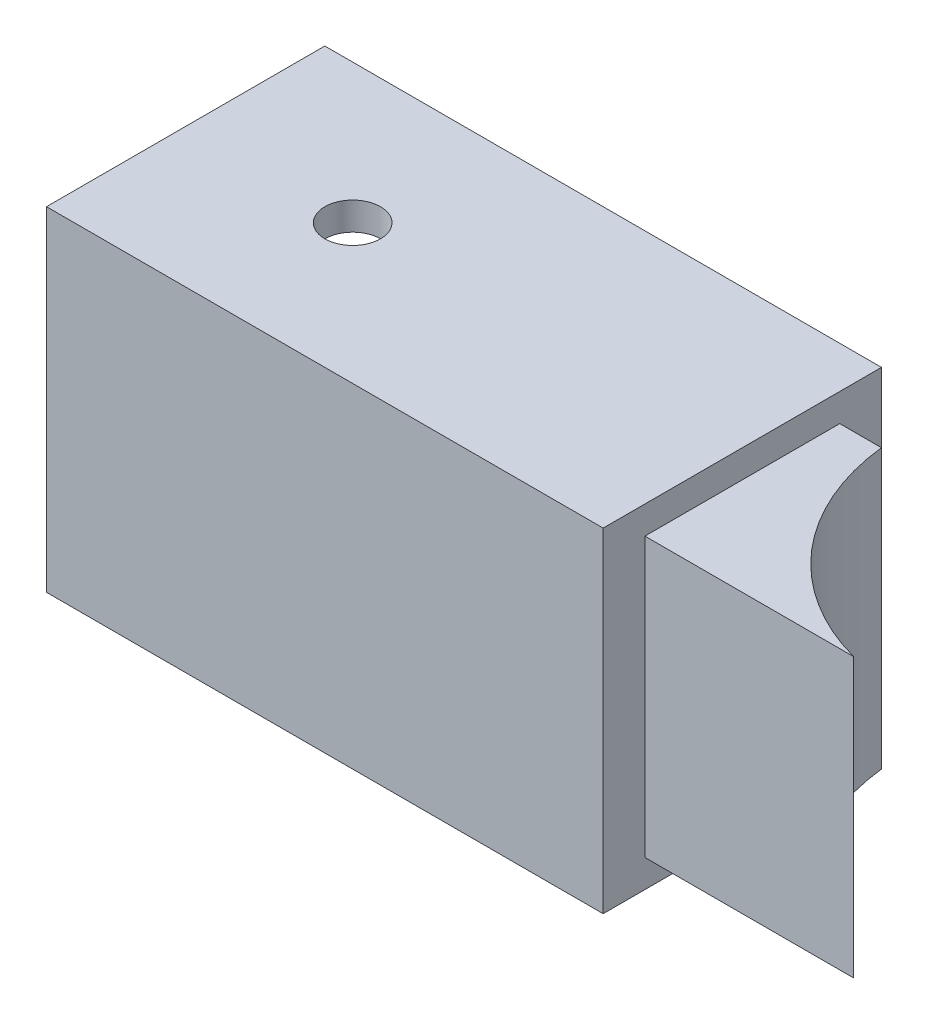
from build123d import *

# Parameters (mm, degrees)
SKETCH2_W               = 100
SKETCH2_H               = 60
BOSS_EXTRUDE1_DEPTH     = 50
SHELL1_T                = -5
SKETCH4_W               = 60
SKETCH4_H               = 50
CUT_EXTRUDE1_DEPTH      = 10
CUT_EXTRUDE2_DEPTH      = 90.582364336
CUT_EXTRUDE2_DEPTH_BACK = 90.582364336
SKETCH5_R               = 5
BOSS_EXTRUDE2_DEPTH     = 60
SKETCH15_W              = 5
SKETCH15_H              = 50
CUT_EXTRUDE4_DEPTH      = 37.5
SHELL3_START            = -20
SHELL3_DEPTH            = 40


# Read off the part's stored shape, not the designer's step: Shell3
with BuildPart() as part:
    # Sketch2 → Boss-Extrude1 (new body)
    with BuildSketch(Plane.XY):
        Rectangle(SKETCH2_W, SKETCH2_H)
    extrude(amount=BOSS_EXTRUDE1_DEPTH)

    # Shell1
    shell1_openings = [part.faces().sort_by_distance(p)[0] for p in [
        (-50, 0, 25),
    ]]
    offset(amount=SHELL1_T, openings=shell1_openings, kind=Kind.INTERSECTION)

    # Sketch4 → Cut-Extrude1 (cut)
    with BuildSketch(Plane.XY.offset(5)):
        with Locations((-20, 0)):
            Rectangle(SKETCH4_W, SKETCH4_H)
    extrude(amount=-CUT_EXTRUDE1_DEPTH, mode=Mode.SUBTRACT)

    # Sketch5 → Cut-Extrude2 (cut, two sides: drawn at the far end of the back side and taken through both)
    with BuildSketch(Plane(origin=(0, -25, 0), x_dir=(1, 0, 0), z_dir=(0, 1, 0)).offset(-CUT_EXTRUDE2_DEPTH_BACK)):
        with Locations(Location((-20, -25, 0), (0, 0, 270))):
            Circle(SKETCH5_R)
    extrude(amount=CUT_EXTRUDE2_DEPTH + CUT_EXTRUDE2_DEPTH_BACK, mode=Mode.SUBTRACT)

    # Sketch13 → Boss-Extrude2 (add)
    with BuildSketch(Plane(origin=(0, 30, 0), x_dir=(1, 0, 0), z_dir=(0, 1, 0))):
        with BuildLine():
            Line((50, -42.5), (57.5, -42.5))
            Line((57.5, -42.5), (87.5, -42.5))
            ThreePointArc((87.5, -42.5), (67.096938471, -29.631195597), (57.5, -7.5))
            Line((57.5, -7.5), (50, -7.5))
            Line((50, -7.5), (50, -42.5))
        make_face()
    extrude(amount=-BOSS_EXTRUDE2_DEPTH)

    # Sketch15 → Cut-Extrude4 (cut)
    with BuildSketch(Plane.YZ.offset(87.5)):
        with Locations((-27.5, 25)):
            Rectangle(SKETCH15_W, SKETCH15_H)
        with Locations((27.5, 25)):
            Rectangle(SKETCH15_W, SKETCH15_H)
    extrude(amount=-CUT_EXTRUDE4_DEPTH, mode=Mode.SUBTRACT)

    # Shell3 outline → Shell3 (cut)
    with BuildSketch(Plane(origin=(0, 0, 0), x_dir=(1, 0, 0), z_dir=(0, 1, 0)).offset(SHELL3_START)):
        with BuildLine():
            Line((53.243409838, -12.5), (45, -12.5))
            Line((45, -12.5), (45, -37.5))
            Line((45, -37.5), (67.860272771, -37.5))
            ThreePointArc((67.860272771, -37.5), (58.527827688, -26.183389184), (53.243409838, -12.5))
        make_face()
    extrude(amount=SHELL3_DEPTH, mode=Mode.SUBTRACT)


solid = part.part
